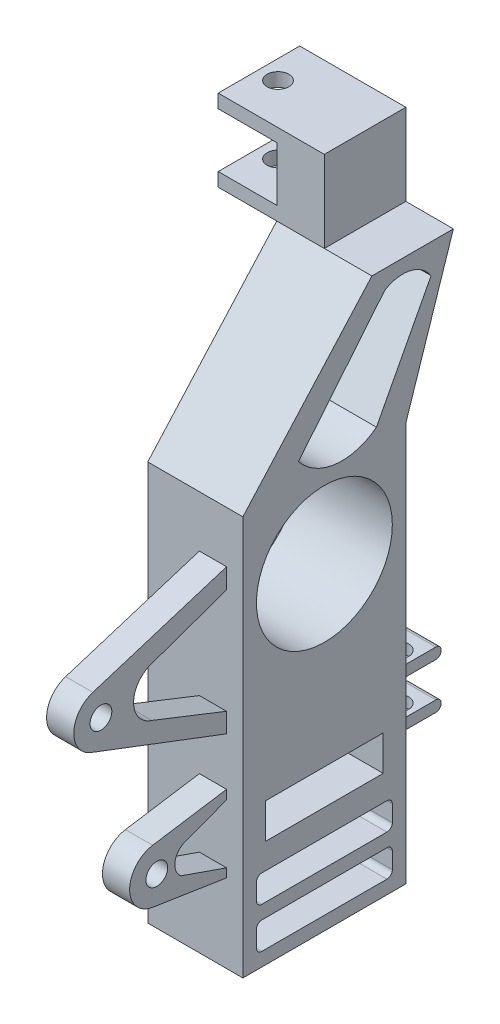
from build123d import *

# Parameters (mm, degrees)
BOSS_EXTRUDE1_DEPTH      = 28
BOSS_EXTRUDE1_DEPTH_BACK = 7
SKETCH1_R                = 25
SKETCH1_W                = 50
SKETCH1_H                = 10
SKETCH3_W                = 21.546368229
SKETCH3_H                = 5
SKETCH3_H_2              = 9.956231156
BOSS_EXTRUDE2_DEPTH      = 35
CUT_EXTRUDE1_DEPTH       = 238.629693409
CUT_EXTRUDE1_DEPTH_BACK  = 40
SKETCH4_R                = 4
SKETCH5_R                = 4
CUT_EXTRUDE2_DEPTH       = 25
SKETCH6_W                = 15.192054263
SKETCH6_H                = 4
BOSS_EXTRUDE4_DEPTH      = 35
SKETCH7_R                = 4
CUT_EXTRUDE3_DEPTH       = 35
BOSS_EXTRUDE5_DEPTH      = 5
BOSS_EXTRUDE5_DEPTH_BACK = 5
SKETCH8_R                = 4
FILLET1_R                = 2
FILLET2_R                = 2
FILLET3_R                = 2
FILLET4_R                = 2
CUT_EXTRUDE6_START       = -7
CUT_EXTRUDE6_DEPTH       = 35
CUT_EXTRUDE8_DEPTH       = 248.462409512
CUT_EXTRUDE9_DEPTH       = 243.60059254
CUT_EXTRUDE9_DEPTH_BACK  = 243.60059254
SKETCH17_W               = 17.5
SKETCH17_H               = 30
CUT_EXTRUDE10_DEPTH      = 243.60059254
SKETCH19_W               = 13.769789611
SKETCH19_H               = 21.894642499
SKETCH19_W_2             = 3.131492763
SKETCH19_H_2             = 18.022692281
CUT_EXTRUDE12_DEPTH      = 243.60059254
CUT_EXTRUDE13_DEPTH      = 243.60059254
CUT_EXTRUDE13_DEPTH_BACK = 243.60059254
SKETCH20_W               = 5
SKETCH20_H               = 30
SKETCH21_W               = 35
SKETCH21_H               = 4.956231156
CUT_EXTRUDE14_DEPTH      = 243.60059254
CUT_EXTRUDE18_DEPTH      = 239.012061805
CUT_EXTRUDE18_DEPTH_BACK = 239.012061805
CUT_EXTRUDE19_DEPTH      = 35
CUT_EXTRUDE19_DEPTH_BACK = 19
CUT_EXTRUDE20_DEPTH      = 239.012061805
CUT_EXTRUDE20_DEPTH_BACK = 239.012061805
SKETCH12_W               = 43.27401944
SKETCH12_H               = 12.898925582
CUT_EXTRUDE24_DEPTH      = 239.012061805
CUT_EXTRUDE24_DEPTH_BACK = 239.012061805
CUT_EXTRUDE26_DEPTH      = 239.012061805
CUT_EXTRUDE26_DEPTH_BACK = 239.012061805
CUT_EXTRUDE27_DEPTH      = 239.012061805
CUT_EXTRUDE27_DEPTH_BACK = 239.012061805
SKETCH29_W               = 2.192054263
SKETCH29_H               = 17.531189733
CUT_EXTRUDE28_DEPTH      = 239.012061805
CUT_EXTRUDE28_DEPTH_BACK = 239.012061805
SKETCH30_W               = 1.330412835
SKETCH30_H               = 17.531189733
CUT_EXTRUDE30_DEPTH      = 239.012061805
CUT_EXTRUDE30_DEPTH_BACK = 239.012061805


# Read off the part's stored shape, not the designer's step: Cut-Extrude6
with BuildPart() as part:
    # Sketch1 → Boss-Extrude1 (new, two sides: drawn at the far end of the back side and taken through both)
    # profile 1 of 3: a face of its own
    with BuildSketch(Plane(origin=(0, 0, 0), x_dir=(0, 0, -1), z_dir=(1, 0, 0)).offset(-BOSS_EXTRUDE1_DEPTH_BACK)):
        Polygon((12.468810267, 220), (12.468810267, 190), (52.468810267, 190), (52.468810267, 205), (52.468810267, 220), align=None)
    # profile 2 of 3: a face of its own
    with BuildSketch(Plane(origin=(0, 0, 0), x_dir=(0, 0, -1), z_dir=(1, 0, 0)).offset(-BOSS_EXTRUDE1_DEPTH_BACK)):
        Polygon((12.468810267, 190), (52.468810267, 190), (30, 136.969027383), (-30, 136.969027383), align=None)
    # profile 3 of 3: a face of its own
    with BuildSketch(Plane(origin=(0, 0, 0), x_dir=(0, 0, -1), z_dir=(1, 0, 0)).offset(-BOSS_EXTRUDE1_DEPTH_BACK)):
        Polygon((-30, 136.969027383), (30, 136.969027383), (30, 106.969027383), (30, 10), (30, -10), (-30, -10), (-30, 10), (-30, 106.969027383), align=None)
        with Locations((0, 106.969027383)):
            Circle(SKETCH1_R, mode=Mode.SUBTRACT)
        Polygon((-25, 20), (-25, 10), (0, 10), (25, 10), (25, 20), align=None, mode=Mode.SUBTRACT)
        Rectangle(SKETCH1_W, SKETCH1_H, mode=Mode.SUBTRACT)
    extrude(amount=BOSS_EXTRUDE1_DEPTH + BOSS_EXTRUDE1_DEPTH_BACK)

    # Sketch3 → Boss-Extrude2 (add)
    with BuildSketch(Plane(origin=(0, 0, -52.468810267), x_dir=(-1, 0, 0), z_dir=(0, 0, -1))):
        with Locations((17.773184115, 192.5)):
            Rectangle(SKETCH3_W, SKETCH3_H)
        with Locations((17.773184115, 219.978115578)):
            Rectangle(SKETCH3_W, SKETCH3_H_2)
    extrude(amount=-BOSS_EXTRUDE2_DEPTH)

    # Sketch4 → Cut-Extrude1 (cut, two sides: drawn at the far end of the back side and taken through both)
    with BuildSketch(Plane(origin=(0, 220, 0), x_dir=(1, 0, 0), z_dir=(0, 1, 0)).offset(-CUT_EXTRUDE1_DEPTH_BACK)):
        with Locations(Location((-21.546368229, 32.468810267, 0), (0, 0, 90))):
            Circle(SKETCH4_R)
    extrude(amount=CUT_EXTRUDE1_DEPTH + CUT_EXTRUDE1_DEPTH_BACK, mode=Mode.SUBTRACT)

    # Sketch5 → Cut-Extrude2 (cut)
    with BuildSketch(Plane.XZ.offset(10)):
        with Locations(Location((0, 0, 0), (0, 0, 270))):
            Circle(SKETCH5_R)
    extrude(amount=-CUT_EXTRUDE2_DEPTH, mode=Mode.SUBTRACT)

    # Sketch6 → Boss-Extrude4 (add)
    with BuildSketch(Plane(origin=(0, 0, -30), x_dir=(-1, 0, 0), z_dir=(0, 0, -1))):
        with Locations((-0.596027132, 35.974427815)):
            Rectangle(SKETCH6_W, SKETCH6_H)
        with Locations((-0.596027132, 19.121539986)):
            Rectangle(SKETCH6_W, SKETCH6_H)
    extrude(amount=BOSS_EXTRUDE4_DEPTH)

    # Sketch7 → Cut-Extrude3 (cut)
    with BuildSketch(Plane.XZ.offset(-17.121539986)):
        with Locations(Location((0, -55, 0), (0, 0, 270))):
            Circle(SKETCH7_R)
    extrude(amount=-CUT_EXTRUDE3_DEPTH, mode=Mode.SUBTRACT)

    # Sketch8 → Boss-Extrude5 (add, two sides: drawn at the far end of the back side and taken through both)
    # profile 1 of 2: a face of its own
    with BuildSketch(Plane(origin=(17, 0, 0), x_dir=(0, 0, -1), z_dir=(1, 0, 0)).offset(-BOSS_EXTRUDE5_DEPTH_BACK)):
        with BuildLine():
            Line((-30, 118.060328993), (-30, 64.802844314))
            Line((-30, 64.802844314), (-79.782583008, 83.7497926))
            ThreePointArc((-79.782583008, 83.7497926), (-86.221055725, 93.395743584), (-79.215750464, 102.638254039))
            Line((-79.215750464, 102.638254039), (-30, 118.060328993))
        make_face()
        with Locations((-76.225555525, 93.095784012)):
            Circle(SKETCH8_R, mode=Mode.SUBTRACT)
    # profile 2 of 2: a face of its own
    with BuildSketch(Plane(origin=(17, 0, 0), x_dir=(0, 0, -1), z_dir=(1, 0, 0)).offset(-BOSS_EXTRUDE5_DEPTH_BACK)):
        with BuildLine():
            Line((-30, 47.125470645), (-30, 18.906005285))
            Line((-30, 18.906005285), (-57.203314441, 23.134394747))
            ThreePointArc((-57.203314441, 23.134394747), (-65.667392499, 33.015737965), (-57.203314441, 42.897081183))
            Line((-57.203314441, 42.897081183), (-30, 47.125470645))
        make_face()
        with Locations((-55.667392499, 33.015737965)):
            Circle(SKETCH8_R, mode=Mode.SUBTRACT)
    extrude(amount=BOSS_EXTRUDE5_DEPTH + BOSS_EXTRUDE5_DEPTH_BACK)

    # Fillet1
    fillet1_edges = [part.edges().sort_by_distance(p)[0] for p in [
        (0.596027131, 37.974427815, -30),
        (0.596027131, 33.974427815, -30),
        (0.596027131, 17.121539986, -30),
        (0.596027131, 21.121539986, -30),
    ]]
    fillet(fillet1_edges, radius=FILLET1_R)

    # Fillet2
    fillet2_edges = [part.edges().sort_by_distance(p)[0] for p in [
        (10.5, -5, 25),
        (10.5, -5, -25),
        (10.5, 10, 25),
        (10.5, 10, -25),
    ]]
    fillet(fillet2_edges, radius=FILLET2_R)

    # Fillet3
    fillet3_edges = [part.edges().sort_by_distance(p)[0] for p in [
        (10.5, 5, 25),
        (10.5, 5, -25),
        (10.5, 20, -25),
        (10.5, 20, 25),
    ]]
    fillet(fillet3_edges, radius=FILLET3_R)

    # Fillet4
    fillet4_edges = [part.edges().sort_by_distance(p)[0] for p in [
        (0.596027131, 17.121539986, -65),
        (0.596027131, 21.121539986, -65),
        (0.596027131, 33.974427815, -65),
        (0.596027131, 37.974427815, -65),
    ]]
    fillet(fillet4_edges, radius=FILLET4_R - 0.0001)  # a hair under: the kernel refuses the full size

    # Cut-Extrude6 outline → Cut-Extrude6 (cut)
    with BuildSketch(Plane(origin=(0, 0, 0), x_dir=(0, 0, -1), z_dir=(1, 0, 0)).offset(CUT_EXTRUDE6_START)):
        Polygon((-30, 136.969027383), (17.468810267, 190), (17.468810267, 220), (12.468810267, 220), (12.468810267, 190), align=None)
    extrude(amount=CUT_EXTRUDE6_DEPTH, mode=Mode.SUBTRACT)

    # Sketch14 → Cut-Extrude8 (cut, through all)
    with BuildSketch(Plane(origin=(28, 0, 0), x_dir=(0, 0, -1), z_dir=(1, 0, 0))):
        with BuildLine():
            Line((34.1686498, 172.523023356), (15.653218162, 146.807146081))
            ThreePointArc((15.653218162, 146.807146081), (6.378159707, 145.297252844), (4.86826647, 154.572311299))
            Line((4.86826647, 154.572311299), (23.383698108, 180.288188574))
            ThreePointArc((23.383698108, 180.288188574), (32.658756563, 181.798081811), (34.1686498, 172.523023356))
        make_face()
    extrude(amount=-CUT_EXTRUDE8_DEPTH, mode=Mode.SUBTRACT)

    # Sketch15 → Cut-Extrude9 (cut, two sides: drawn at the far end of the back side and taken through both)
    with BuildSketch(Plane(origin=(0, 0, 0), x_dir=(0, 0, -1), z_dir=(1, 0, 0)).offset(-CUT_EXTRUDE9_DEPTH_BACK)):
        Polygon((-43.769789611, 101.48799534), (-43.769789611, 79.593352841), (-61.94647395, 90.54067409), align=None)
        Polygon((-33.131492763, 42.696931743), (-33.131492763, 24.674239462), (-48.093727864, 33.685585602), align=None)
    extrude(amount=CUT_EXTRUDE9_DEPTH + CUT_EXTRUDE9_DEPTH_BACK, mode=Mode.SUBTRACT)

    # Sketch17 → Cut-Extrude10 (cut, through all)
    with BuildSketch(Plane.XY):
        with Locations((19.25, 205)):
            Rectangle(SKETCH17_W, SKETCH17_H)
    extrude(amount=-CUT_EXTRUDE10_DEPTH, mode=Mode.SUBTRACT)

    # Sketch19 → Cut-Extrude12 (cut, through all)
    with BuildSketch(Plane(origin=(0, 0, 0), x_dir=(0, 0, -1), z_dir=(1, 0, 0))):
        with Locations((-36.884894806, 90.540674091)):
            Rectangle(SKETCH19_W, SKETCH19_H)
        with Locations((-31.565746382, 33.685585602)):
            Rectangle(SKETCH19_W_2, SKETCH19_H_2)
    extrude(amount=CUT_EXTRUDE12_DEPTH, mode=Mode.SUBTRACT)

    # Sketch20 → Cut-Extrude13 (cut, two sides: drawn at the far end of the back side and taken through both)
    with BuildSketch(Plane(origin=(0, 0, 0), x_dir=(0, 0, -1), z_dir=(1, 0, 0)).offset(-CUT_EXTRUDE13_DEPTH_BACK)):
        with Locations((49.968810267, 205)):
            Rectangle(SKETCH20_W, SKETCH20_H)
    extrude(amount=CUT_EXTRUDE13_DEPTH + CUT_EXTRUDE13_DEPTH_BACK, mode=Mode.SUBTRACT)

    # Sketch21 → Cut-Extrude14 (cut, through all)
    with BuildSketch(Plane(origin=(0, 0, 0), x_dir=(0, 0, -1), z_dir=(1, 0, 0))):
        with Locations((34.968810267, 222.478115578)):
            Rectangle(SKETCH21_W, SKETCH21_H)
    extrude(amount=-CUT_EXTRUDE14_DEPTH, mode=Mode.SUBTRACT)

    # Sketch23 → Cut-Extrude18 (cut, two sides: drawn at the far end of the back side and taken through both)
    with BuildSketch(Plane(origin=(0, 0, 0), x_dir=(0, 0, -1), z_dir=(1, 0, 0)).offset(-CUT_EXTRUDE18_DEPTH_BACK)):
        Polygon((30, 136.969027383), (47.468810267, 190), (52.468810267, 190), align=None)
    extrude(amount=CUT_EXTRUDE18_DEPTH + CUT_EXTRUDE18_DEPTH_BACK, mode=Mode.SUBTRACT)

    # Sketch24 → Cut-Extrude19 (cut, two sides: drawn at the far end of the back side and taken through both)
    with BuildSketch(Plane(origin=(0, 0, 0), x_dir=(0, 0, -1), z_dir=(1, 0, 0)).offset(-CUT_EXTRUDE19_DEPTH_BACK)):
        with BuildLine():
            Line((22.176119959, 182.997319441), (-9.542666893, 144.340047966))
            ThreePointArc((-9.542666893, 144.340047966), (4.104511603, 136.704920477), (19.153374483, 140.956082513))
            Line((19.153374483, 140.956082513), (39.259857136, 179.186718543))
            ThreePointArc((39.259857136, 179.186718543), (31.507189834, 184.630176809), (22.176119959, 182.997319441))
        make_face()
    extrude(amount=CUT_EXTRUDE19_DEPTH + CUT_EXTRUDE19_DEPTH_BACK, mode=Mode.SUBTRACT)

    # Sketch12 → Cut-Extrude20 (cut, two sides: drawn at the far end of the back side and taken through both)
    with BuildSketch(Plane(origin=(0, 0, 0), x_dir=(0, 0, -1), z_dir=(1, 0, 0)).offset(-CUT_EXTRUDE20_DEPTH_BACK)):
        with Locations((0, 35.83943368)):
            Rectangle(SKETCH12_W, SKETCH12_H)
    extrude(amount=CUT_EXTRUDE20_DEPTH + CUT_EXTRUDE20_DEPTH_BACK, mode=Mode.SUBTRACT)

    # Sketch26 → Cut-Extrude24 (cut, two sides: drawn at the far end of the back side and taken through both)
    with BuildSketch(Plane(origin=(0, 0, 0), x_dir=(0, 0, -1), z_dir=(1, 0, 0)).offset(-CUT_EXTRUDE24_DEPTH_BACK)):
        with BuildLine():
            Line((-30, 110.685727942), (-57.547040207, 100.950800214))
            ThreePointArc((-57.547040207, 100.950800214), (-64.213889767, 91.901890883), (-57.547040207, 82.852981552))
            Line((-57.547040207, 82.852981552), (-30, 72.007357372))
            Line((-30, 72.007357372), (-30, 110.685727942))
        make_face()
    extrude(amount=CUT_EXTRUDE24_DEPTH + CUT_EXTRUDE24_DEPTH_BACK, mode=Mode.SUBTRACT)

    # Sketch28 → Cut-Extrude26 (cut, two sides: drawn at the far end of the back side and taken through both)
    with BuildSketch(Plane(origin=(0, 0, 0), x_dir=(0, 0, -1), z_dir=(1, 0, 0)).offset(-CUT_EXTRUDE26_DEPTH_BACK)):
        with BuildLine():
            Line((-30, 43.793670296), (-44.199366323, 38.404428428))
            ThreePointArc((-44.199366323, 38.404428428), (-48.048196325, 34.271707278), (-45.635023396, 29.16587993))
            Line((-45.635023396, 29.16587993), (-30, 23.168887083))
            Line((-30, 23.168887083), (-30, 43.793670296))
        make_face()
    extrude(amount=CUT_EXTRUDE26_DEPTH + CUT_EXTRUDE26_DEPTH_BACK, mode=Mode.SUBTRACT)

    # Sketch29 → Cut-Extrude27 (cut, two sides: drawn at the far end of the back side and taken through both)
    with BuildSketch(Plane(origin=(0, 0, 0), x_dir=(1, 0, 0), z_dir=(0, 1, 0)).offset(-CUT_EXTRUDE27_DEPTH_BACK)):
        with Locations((7.096027132, 56.234405134)):
            Rectangle(SKETCH29_W, SKETCH29_H)
    extrude(amount=CUT_EXTRUDE27_DEPTH + CUT_EXTRUDE27_DEPTH_BACK, mode=Mode.SUBTRACT)

    # Sketch30 → Cut-Extrude28 (cut, two sides: drawn at the far end of the back side and taken through both)
    with BuildSketch(Plane(origin=(0, 0, 0), x_dir=(1, 0, 0), z_dir=(0, 1, 0)).offset(-CUT_EXTRUDE28_DEPTH_BACK)):
        with Locations((-6.334793582, 56.234405134)):
            Rectangle(SKETCH30_W, SKETCH30_H)
    extrude(amount=CUT_EXTRUDE28_DEPTH + CUT_EXTRUDE28_DEPTH_BACK, mode=Mode.SUBTRACT)

    # Sketch31 → Cut-Extrude30 (cut, two sides: drawn at the far end of the back side and taken through both)
    with BuildSketch(Plane(origin=(0, 0, 0), x_dir=(0, 0, -1), z_dir=(1, 0, 0)).offset(-CUT_EXTRUDE30_DEPTH_BACK)):
        with BuildLine():
            Line((-30, 22.113316023), (-46.768850349, 27.951925747))
            ThreePointArc((-46.768850349, 27.951925747), (-48.864559319, 34.00917566), (-44.199366323, 38.404428428))
            Line((-44.199366323, 38.404428428), (-30, 43.793670296))
            Line((-30, 43.793670296), (-30, 22.113316023))
        make_face()
    extrude(amount=CUT_EXTRUDE30_DEPTH + CUT_EXTRUDE30_DEPTH_BACK, mode=Mode.SUBTRACT)


solid = part.part
